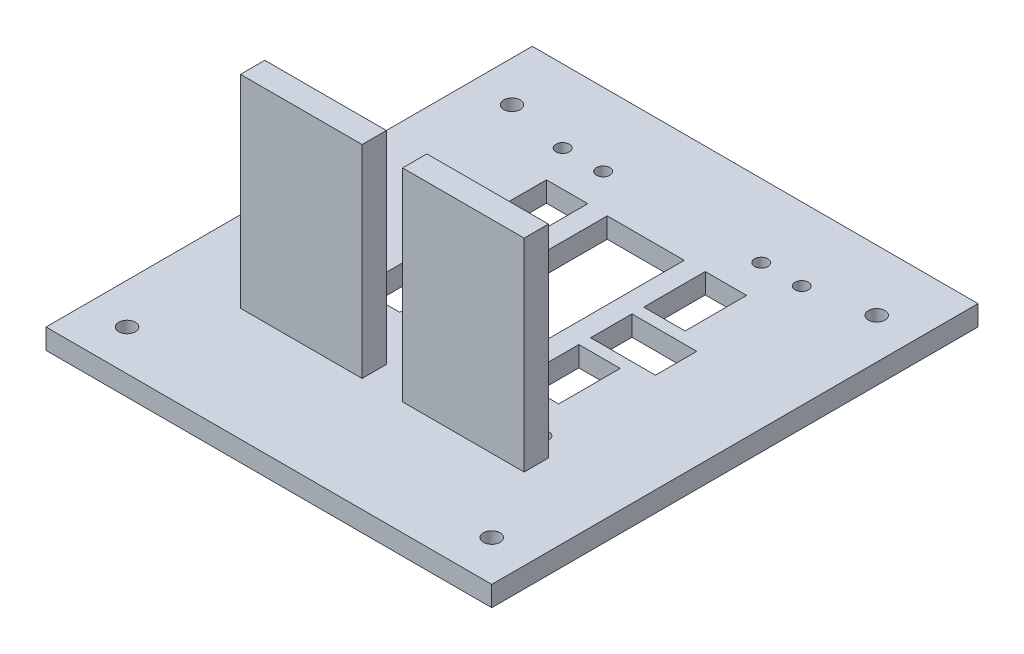
from build123d import *

# Parameters (mm, degrees)
SKETCH1_R           = 1.65
SKETCH1_W           = 19
SKETCH1_H           = 46
BOSS_EXTRUDE3_DEPTH = 5
SKETCH5_R           = 2.05
CUT_EXTRUDE2_DEPTH  = 90.162772501
SKETCH9_W           = 10.2
SKETCH9_H           = 15.2
CUT_EXTRUDE3_DEPTH  = 90.162772501
SKETCH6_W           = 30
SKETCH6_H           = 6
BOSS_EXTRUDE4_DEPTH = 50
SKETCH11_W          = 16
SKETCH11_H          = 10.2
CUT_EXTRUDE4_DEPTH  = 103.102889283


with BuildPart() as part:
    # Sketch1 → Boss-Extrude3 (new body)
    with BuildSketch(Plane(origin=(0, 0, 0), x_dir=(1, 0, 0), z_dir=(0, 1, 0))):
        Polygon((55, 50), (-55, 50), (-55, 31.75), (-55, -31.75), (-55, -70), (-20, -70), (2.5, -70), (20, -70), (42.5, -70), (55, -70), (55, -31.75), (55, 31.75), align=None)
        with Locations((-29.5, -32)):
            Circle(SKETCH1_R, mode=Mode.SUBTRACT)
        with Locations((-19.5, -32)):
            Circle(SKETCH1_R, mode=Mode.SUBTRACT)
        with Locations((19.5, -32)):
            Circle(SKETCH1_R, mode=Mode.SUBTRACT)
        with Locations((29.5, -32)):
            Circle(SKETCH1_R, mode=Mode.SUBTRACT)
        with Locations((-29.5, 32)):
            Circle(SKETCH1_R, mode=Mode.SUBTRACT)
        with Locations((-19.5, 32)):
            Circle(SKETCH1_R, mode=Mode.SUBTRACT)
        Rectangle(SKETCH1_W, SKETCH1_H, mode=Mode.SUBTRACT)
        with Locations((19.5, 32)):
            Circle(SKETCH1_R, mode=Mode.SUBTRACT)
        with Locations((29.5, 32)):
            Circle(SKETCH1_R, mode=Mode.SUBTRACT)
    extrude(amount=BOSS_EXTRUDE3_DEPTH)

    # Sketch5 → Cut-Extrude2 (cut, through all)
    with BuildSketch(Plane.XZ):
        with Locations((-45, 60)):
            Circle(SKETCH5_R)
        with Locations((-45, -35)):
            Circle(SKETCH5_R)
        with Locations((45, -35)):
            Circle(SKETCH5_R)
        with Locations((45, 60)):
            Circle(SKETCH5_R)
    extrude(amount=-CUT_EXTRUDE2_DEPTH, mode=Mode.SUBTRACT)

    # Sketch9 → Cut-Extrude3 (cut, through all)
    with BuildSketch(Plane(origin=(0, 5, 0), x_dir=(1, 0, 0), z_dir=(0, 1, 0))):
        with Locations((-19.6, 15.6)):
            Rectangle(SKETCH9_W, SKETCH9_H)
        with Locations((-19.6, -15.6)):
            Rectangle(SKETCH9_W, SKETCH9_H)
        with Locations((19.6, -15.6)):
            Rectangle(SKETCH9_W, SKETCH9_H)
        with Locations((19.6, 15.6)):
            Rectangle(SKETCH9_W, SKETCH9_H)
    extrude(amount=-CUT_EXTRUDE3_DEPTH, mode=Mode.SUBTRACT)

    # Sketch6 → Boss-Extrude4 (add)
    with BuildSketch(Plane(origin=(0, 5, 0), x_dir=(1, 0, 0), z_dir=(0, 1, 0))):
        with Locations((-20, -39)):
            Rectangle(SKETCH6_W, SKETCH6_H)
        with Locations((20, -39)):
            Rectangle(SKETCH6_W, SKETCH6_H)
    extrude(amount=BOSS_EXTRUDE4_DEPTH)

    # Sketch11 → Cut-Extrude4 (cut, through all)
    with BuildSketch(Plane(origin=(0, 5, 0), x_dir=(1, 0, 0), z_dir=(0, 1, 0))):
        with Locations((22.5, 0)):
            Rectangle(SKETCH11_W, SKETCH11_H)
    extrude(amount=-CUT_EXTRUDE4_DEPTH, mode=Mode.SUBTRACT)


solid = part.part
